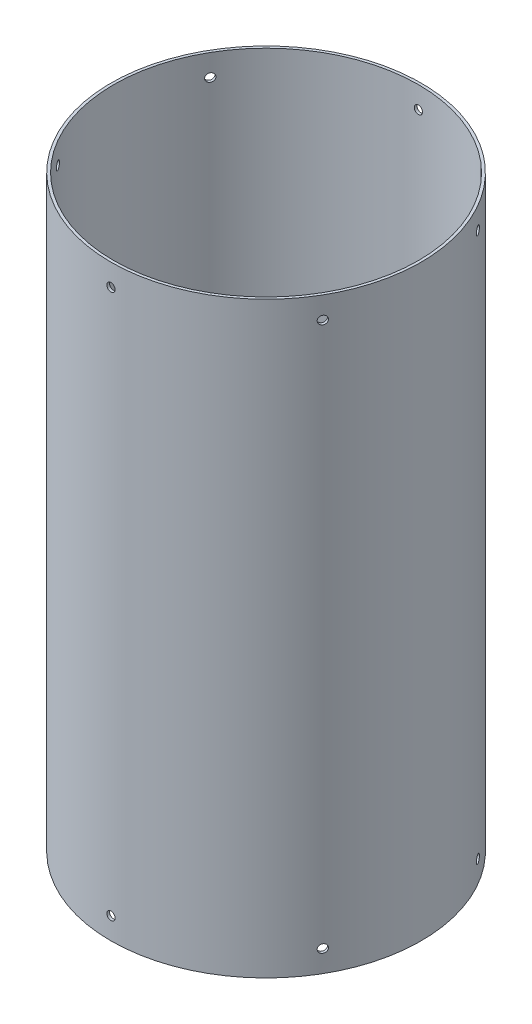
from build123d import *

# Parameters (mm, degrees)
SKETCH2_R           = 90.4875
SKETCH2_R_2         = 88.9
BOSS_EXTRUDE1_DEPTH = 342.9
SKETCH3_R           = 2.413
CUT_EXTRUDE1_DEPTH  = 367.000526383
CIRPATTERN1_COUNT   = 6


with BuildPart() as part:
    # Sketch2 → Boss-Extrude1 (new body)
    with BuildSketch(Plane(origin=(0, 0, 0), x_dir=(1, 0, 0), z_dir=(0, 1, 0))):
        Circle(SKETCH2_R)
        Circle(SKETCH2_R_2, mode=Mode.SUBTRACT)
    extrude(amount=BOSS_EXTRUDE1_DEPTH)

    # Sketch3 → Cut-Extrude1 (cut, symmetric)
    with BuildSketch(Plane.XY):
        with Locations((0, 330.2)):
            Circle(SKETCH3_R)
        with Locations((0, 12.7)):
            Circle(SKETCH3_R)
    cut_extrude1 = extrude(amount=CUT_EXTRUDE1_DEPTH, both=True, mode=Mode.SUBTRACT)

    # CirPattern1: Cut-Extrude1 ×6 about axis
    cirpattern1_axis = Axis((0, 342.9, 0), (0, 1, 0))
    for i in range(1, CIRPATTERN1_COUNT):
        add(cut_extrude1.rotate(cirpattern1_axis, i * 360 / CIRPATTERN1_COUNT), mode=Mode.SUBTRACT)


solid = part.part
